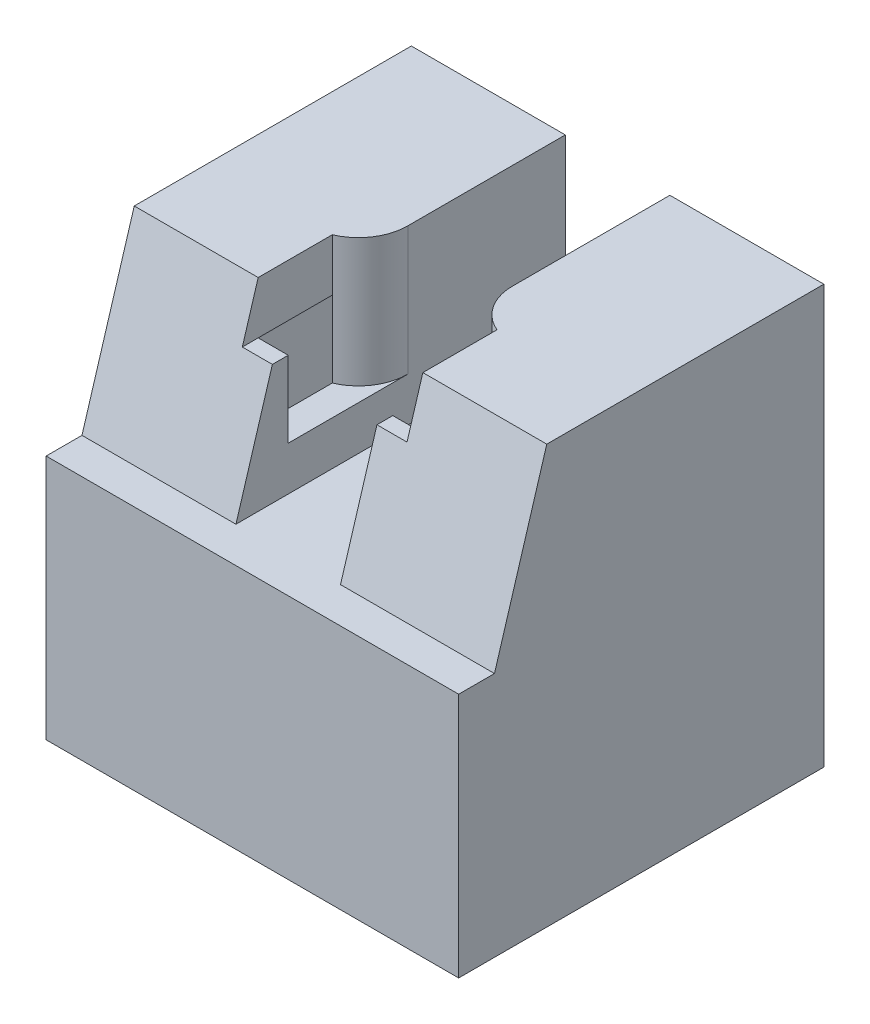
from build123d import *

# Parameters (mm, degrees)
SKETCH2_W           = 18.7
SKETCH2_H           = 20
BOSS_EXTRUDE1_DEPTH = 25.4
SKETCH3_W           = 6.35
SKETCH3_H           = 3.175
SKETCH3_H_2         = 4.125
CUT_EXTRUDE1_DEPTH  = 34.653863077
SKETCH5_W           = 3.175
SKETCH5_H           = 25.4
BOSS_EXTRUDE2_DEPTH = 20
SKETCH6_W           = 10
SKETCH6_H           = 10.125
CUT_EXTRUDE2_DEPTH  = 16.825
CUT_EXTRUDE3_REACH  = 34.439
SKETCH7_W           = 3
SKETCH7_H           = 3.5
SKETCH8_W           = 22
SKETCH8_H           = 10.125
CUT_EXTRUDE4_DEPTH  = 19
SKETCH9_W           = 2.175
SKETCH9_H           = 14.925
BOSS_EXTRUDE3_DEPTH = 25.05
SKETCH10_W          = 1.825
SKETCH10_H          = 7.8
CUT_EXTRUDE5_DEPTH  = 4.5
CUT_EXTRUDE6_DEPTH  = 38.694736038
SKETCH15_W          = 0.962350835
SKETCH15_H          = 3.175
CUT_EXTRUDE8_DEPTH  = 10
FILLET1_R           = 3


with BuildPart() as part:
    # Sketch2 → Boss-Extrude1 (new body)
    with BuildSketch(Plane(origin=(0, 0, 0), x_dir=(1, 0, 0), z_dir=(0, 1, 0))):
        Rectangle(SKETCH2_W, SKETCH2_H)
    extrude(amount=BOSS_EXTRUDE1_DEPTH)

    # Sketch3 → Cut-Extrude1 (cut, through all)
    with BuildSketch(Plane(origin=(0, 0, -10), x_dir=(-1, 0, 0), z_dir=(0, 0, -1))):
        with Locations((0, 16.5125)):
            Rectangle(SKETCH3_W, SKETCH3_H)
        with Locations((0, 20.1625)):
            Rectangle(SKETCH3_W, SKETCH3_H_2)
        with Locations((0, 23.8125)):
            Rectangle(SKETCH3_W, SKETCH3_H)
    extrude(amount=-CUT_EXTRUDE1_DEPTH, mode=Mode.SUBTRACT)

    # Sketch5 → Boss-Extrude2 (add)
    with BuildSketch(Plane(origin=(0, 0, -10), x_dir=(-1, 0, 0), z_dir=(0, 0, -1))):
        with Locations((-10.9375, 12.7)):
            Rectangle(SKETCH5_W, SKETCH5_H)
        with Locations((10.9375, 12.7)):
            Rectangle(SKETCH5_W, SKETCH5_H)
    extrude(amount=-BOSS_EXTRUDE2_DEPTH)

    # Sketch6 → Cut-Extrude2 (cut)
    with BuildSketch(Plane(origin=(0, 0, -10), x_dir=(-1, 0, 0), z_dir=(0, 0, -1))):
        Polygon((5, 22.225), (5, 10.125), (5, 0), (9.35, 0), (9.35, 22.225), align=None)
        with Locations((0, 5.0625)):
            Rectangle(SKETCH6_W, SKETCH6_H)
        Polygon((-5, 22.225), (-9.35, 22.225), (-9.35, 0), (-5, 0), (-5, 10.125), align=None)
    extrude(amount=-CUT_EXTRUDE2_DEPTH, mode=Mode.SUBTRACT)

    # Cut-Extrude3: up to this face of the body (flat: up to its plane)
    cut_extrude3_end = Plane(part.part.faces().sort_by_distance((-5, 16.175, -1.5875))[0])
    # Sketch7 → Cut-Extrude3 (cut, up to the picked face)
    with BuildSketch(Plane(origin=(5, 0, 0), x_dir=(0, 0, -1), z_dir=(1, 0, 0)), mode=Mode.PRIVATE) as cut_extrude3_sk1:
        with Locations((-4.825, 19.725)):
            Rectangle(SKETCH7_W, SKETCH7_H)
    cut_extrude3_tool1 = split(extrude(cut_extrude3_sk1.sketch, amount=-CUT_EXTRUDE3_REACH, mode=Mode.PRIVATE), bisect_by=cut_extrude3_end, keep=Keep.BOTH, mode=Mode.PRIVATE)
    add(cut_extrude3_tool1.solids().sort_by(Axis((5, 19.725, 4.825), (-1, 0, 0)))[0], mode=Mode.SUBTRACT)

    # Sketch8 → Cut-Extrude4 (cut)
    with BuildSketch(Plane(origin=(0, 0, -10), x_dir=(-1, 0, 0), z_dir=(0, 0, -1))):
        with Locations((0, 5.0625)):
            Rectangle(SKETCH8_W, SKETCH8_H)
    extrude(amount=-CUT_EXTRUDE4_DEPTH, mode=Mode.SUBTRACT)

    # Sketch9 → Boss-Extrude3 (add)
    with BuildSketch(Plane(origin=(12.525, 0, 0), x_dir=(0, 0, -1), z_dir=(1, 0, 0))):
        with Locations((-11.0875, 7.4625)):
            Rectangle(SKETCH9_W, SKETCH9_H)
    extrude(amount=-BOSS_EXTRUDE3_DEPTH)

    # Sketch10 → Cut-Extrude5 (cut)
    with BuildSketch(Plane(origin=(0, 0, 2.325), x_dir=(-1, 0, 0), z_dir=(0, 0, -1))):
        with Locations((-4.0875, 21.5)):
            Rectangle(SKETCH10_W, SKETCH10_H)
        with Locations((4.0875, 21.5)):
            Rectangle(SKETCH10_W, SKETCH10_H)
    extrude(amount=-CUT_EXTRUDE5_DEPTH, mode=Mode.SUBTRACT)

    # Sketch11 → Cut-Extrude6 (cut, through all)
    with BuildSketch(Plane(origin=(12.525, 0, 0), x_dir=(0, 0, -1), z_dir=(1, 0, 0))):
        Polygon((-10, 14.925), (-6.825, 25.4), (-10, 25.4), align=None)
    extrude(amount=-CUT_EXTRUDE6_DEPTH, mode=Mode.SUBTRACT)

    # Sketch15 → Cut-Extrude8 (cut)
    with BuildSketch(Plane(origin=(-5, 0, 0), x_dir=(0, 0, -1), z_dir=(1, 0, 0))):
        with Locations((-7.306175418, 23.8125)):
            Rectangle(SKETCH15_W, SKETCH15_H)
    extrude(amount=CUT_EXTRUDE8_DEPTH, mode=Mode.SUBTRACT)

    # Fillet1
    # the kernel refuses this fillet: 3 mm, written as the material it takes off along each edge
    with BuildSketch(Plane(origin=(3.175, 32.300803848, 2.325), x_dir=(0, 0, -1), z_dir=(0, -1, 0)), Plane(origin=(-3.175, 17.6, 2.325), x_dir=(0, 0, -1), z_dir=(0, 1, 0))) as fillet1_piece_1:
        with BuildLine():
            CenterArc((2.760321539, 3), FILLET1_R, 203.058244088, 66.941755912)
            Line((0, 1.825), (-0.055206431, 1.8015))
            ThreePointArc((-0.055206431, 1.8015), (-0.06, 0.9125), (-0.06, 0))
            Line((-0.06, 0), (0, -0.06))
            Line((0, -0.06), (2.760321539, -0.06))
            Line((2.760321539, -0.06), (2.760321539, 0))
        make_face()
    extrude(amount=14.700803848, mode=Mode.SUBTRACT)


solid = part.part
